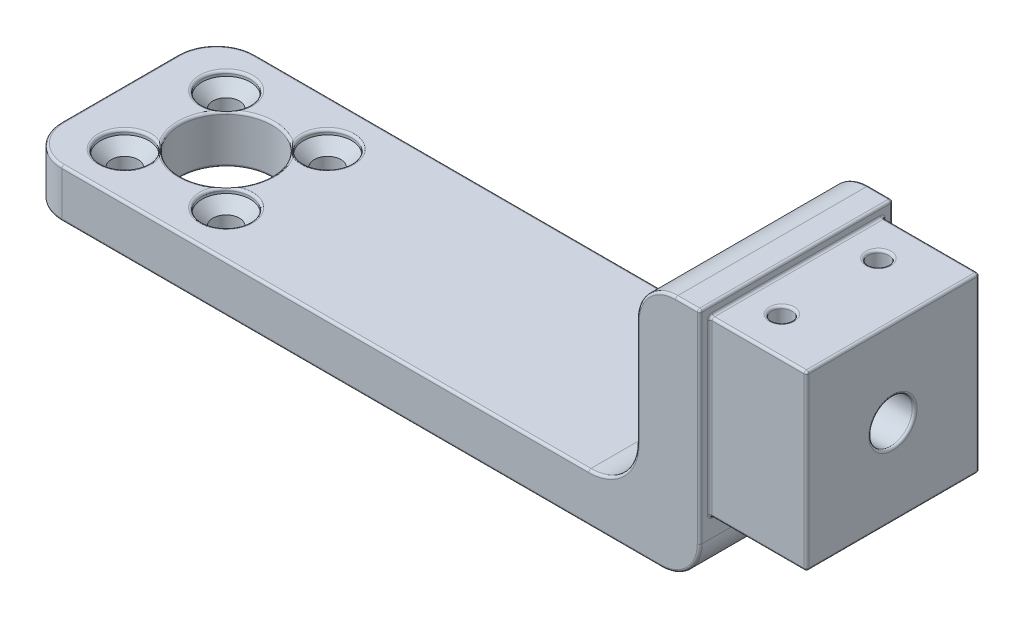
from build123d import *

# Parameters (mm, degrees)
AUFSATZ_LINEAR_AUSTRAGEN1_DEPTH              = 40
SKIZZE2_W                                    = 55.092031508714
SKIZZE2_H                                    = 41.20072241810142
SCHNITT_LINEAR_AUSTRAGEN1_DEPTH              = 20
SCHNITT_LINEAR_AUSTRAGEN2_DEPTH              = 173.33687939614086
SCHNITT_LINEAR_AUSTRAGEN2_DEPTH_BACK         = 173.33687939614086
SKIZZE4_R                                    = 9.500000000000002
FORMSENKUNG_F_R_M5_LINSENSENKSCHRAUB_2_COUNT = 2
FORMSENKUNG_F_R_M5_LINSENSENKSCHRAUB_2_PITCH = 21
FORMSENKUNG_F_R_M5_LINSENSENKSCHRAUB_3_COUNT = 2
FORMSENKUNG_F_R_M5_LINSENSENKSCHRAUB_3_PITCH = 29.698484809834994
FORMSENKUNG_F_R_M5_LINSENSENKSCHRAUB_4_COUNT = 2
FORMSENKUNG_F_R_M5_LINSENSENKSCHRAUB_4_PITCH = 20.999999999999996
VERRUNDUNG1_R                                = 8
M5_GEWINDEBOHRUNG1_D                         = 4.2
M5_GEWINDEBOHRUNG1_DEPTH                     = 15
M5_GEWINDEBOHRUNG1_TIP                       = 1.2618072999578767
M5_GEWINDEBOHRUNG2_D                         = 4.2
M5_GEWINDEBOHRUNG2_DEPTH                     = 15
M5_GEWINDEBOHRUNG2_TIP                       = 1.2618072999578767
SCHNITT_LINEAR_AUSTRAGEN3_REACH              = 174.337
SKIZZE12_R                                   = 4.500000000000003
VERRUNDUNG2_R                                = 10
VERRUNDUNG3_R                                = 0.5


with BuildPart() as part:
    # Skizze1 → Aufsatz-Linear austragen1 (new body)
    with BuildSketch(Plane.XY):
        Polygon((0, 0), (140, 0), (140, 12.09999999999999), (160, 12.099999999999984), (160, 47.900000000000006), (140, 47.9), (140, 50), (127, 50), (127, 10.000000000000005), (0, 10), align=None)
    extrude(amount=AUFSATZ_LINEAR_AUSTRAGEN1_DEPTH)

    # Skizze2 → Schnitt-Linear austragen1 (cut)
    with BuildSketch(Plane(origin=(160, 0, 0), x_dir=(0, 0, -1), z_dir=(1, 0, 0))):
        with Locations((-21.149401969108084, 29.399638790949282)):
            Rectangle(SKIZZE2_W, SKIZZE2_H)
        Polygon((-37.900000000000006, 12.09999999999999), (-2.0999999999999837, 12.099999999999996), (-2.099999999999998, 47.90000000000001), (-37.900000000000006, 47.900000000000006), align=None, mode=Mode.SUBTRACT)
    extrude(amount=-SCHNITT_LINEAR_AUSTRAGEN1_DEPTH, mode=Mode.SUBTRACT)

    # Skizze4 → Schnitt-Linear austragen2 (cut, two sides: drawn at the far end of the back side and taken through both)
    with BuildSketch(Plane.XZ.offset(-SCHNITT_LINEAR_AUSTRAGEN2_DEPTH_BACK)):
        with Locations((22, 20)):
            Circle(SKIZZE4_R)
    extrude(amount=SCHNITT_LINEAR_AUSTRAGEN2_DEPTH + SCHNITT_LINEAR_AUSTRAGEN2_DEPTH_BACK, mode=Mode.SUBTRACT)

    # Skizze6 → Formsenkung für M5 Linsensenkschraube mit Schlitz1 (revolve, cut)
    with BuildSketch(Plane(origin=(32.5, 10.000000000000002, 30.49999999999999), x_dir=(0, 0, 1), z_dir=(1, 4e-17, 0))):
        Polygon((0, 0), (-4.57e-15, 18.75236670232579), (2.749999999999996, 17.1), (2.7500000000000013, 3.249999999999996), (5, 1), (5, 0), align=None)
    formsenkung_f_r_m5_linsensenkschraube_mi = revolve(axis=Axis((32.5, 16.349999999999994, 30.49999999999999), (6e-17, -1, 0)), mode=Mode.SUBTRACT)

    # Formsenkung f_r M5 Linsensenkschraub 2: Formsenkung für M5 Linsensenkschraube mit Schlitz1 ×2
    with Locations(*[(-i * FORMSENKUNG_F_R_M5_LINSENSENKSCHRAUB_2_PITCH, 0, 0) for i in range(1, FORMSENKUNG_F_R_M5_LINSENSENKSCHRAUB_2_COUNT)]):
        add(formsenkung_f_r_m5_linsensenkschraube_mi, mode=Mode.SUBTRACT)

    # Formsenkung f_r M5 Linsensenkschraub 3: Formsenkung für M5 Linsensenkschraube mit Schlitz1 ×2
    with Locations(*[Vector(-0.7071067811865477, 0, -0.7071067811865474) * (i * FORMSENKUNG_F_R_M5_LINSENSENKSCHRAUB_3_PITCH) for i in range(1, FORMSENKUNG_F_R_M5_LINSENSENKSCHRAUB_3_COUNT)]):
        add(formsenkung_f_r_m5_linsensenkschraube_mi, mode=Mode.SUBTRACT)

    # Formsenkung f_r M5 Linsensenkschraub 4: Formsenkung für M5 Linsensenkschraube mit Schlitz1 ×2
    with Locations(*[(0, 0, -i * FORMSENKUNG_F_R_M5_LINSENSENKSCHRAUB_4_PITCH) for i in range(1, FORMSENKUNG_F_R_M5_LINSENSENKSCHRAUB_4_COUNT)]):
        add(formsenkung_f_r_m5_linsensenkschraube_mi, mode=Mode.SUBTRACT)

    # Verrundung1
    verrundung1_edges = [part.edges().sort_by_distance(p)[0] for p in [
        (0, 5, 0),
        (127, 50, 20),
        (140, 0, 20),
        (0, 5, 40),
    ]]
    fillet(verrundung1_edges, radius=VERRUNDUNG1_R)

    # M5 Gewindebohrung1
    with Locations(Plane(origin=(-1.662e-14, 47.89999999999995, 0), x_dir=(1, 3.5e-16, 0), z_dir=(-3.5e-16, 1, 0))):
        with Locations((147, -10), (147, -30)):
            Hole(M5_GEWINDEBOHRUNG1_D / 2, depth=M5_GEWINDEBOHRUNG1_DEPTH)
            with Locations((0, 0, -(M5_GEWINDEBOHRUNG1_DEPTH + M5_GEWINDEBOHRUNG1_TIP / 2))):  # 118° drill point
                Cone(0, M5_GEWINDEBOHRUNG1_D / 2, M5_GEWINDEBOHRUNG1_TIP, mode=Mode.SUBTRACT)

    # M5 Gewindebohrung2
    with Locations(Plane(origin=(4.2e-15, 12.100000000000039, 0), x_dir=(-1, 3.5e-16, 0), z_dir=(-3.5e-16, -1, 0))):
        with Locations((-147, -10), (-147, -30)):
            Hole(M5_GEWINDEBOHRUNG2_D / 2, depth=M5_GEWINDEBOHRUNG2_DEPTH)
            with Locations((0, 0, -(M5_GEWINDEBOHRUNG2_DEPTH + M5_GEWINDEBOHRUNG2_TIP / 2))):  # 118° drill point
                Cone(0, M5_GEWINDEBOHRUNG2_D / 2, M5_GEWINDEBOHRUNG2_TIP, mode=Mode.SUBTRACT)

    # Skizze12 → Schnitt-Linear austragen3 (cut, up to next)
    with BuildSketch(Plane(origin=(160, 0, 0), x_dir=(0, 0, -1), z_dir=(1, 0, 0)), mode=Mode.PRIVATE) as schnitt_linear_austragen3_sk1:
        with Locations((-20, 30.000000000000007)):
            Circle(SKIZZE12_R)
    schnitt_linear_austragen3_tool1 = extrude(schnitt_linear_austragen3_sk1.sketch, amount=-SCHNITT_LINEAR_AUSTRAGEN3_REACH, mode=Mode.PRIVATE) & part.part
    add(schnitt_linear_austragen3_tool1.solids().sort_by_distance((160, 30, 20))[0], mode=Mode.SUBTRACT)

    # Verrundung2
    verrundung2_edges = [part.edges().sort_by_distance(p)[0] for p in [
        (127, 10.000000000000005, 20),
    ]]
    fillet(verrundung2_edges, radius=VERRUNDUNG2_R)

    # Verrundung3
    # the kernel refuses this fillet: 0.5 mm, written as the material it takes off along each edge
    with BuildSketch(Plane(origin=(139.5, 49.5, 0.5), x_dir=(1, 0, 0), z_dir=(0, 0, -1))) as verrundung3_piece_1_section:
        Polygon((0, 0), (VERRUNDUNG3_R, 0), (VERRUNDUNG3_R, -VERRUNDUNG3_R), (0, -VERRUNDUNG3_R), align=None)
    verrundung3_piece_1 = extrude(amount=VERRUNDUNG3_R, mode=Mode.PRIVATE)
    verrundung3_piece_1 = verrundung3_piece_1 - Plane(origin=(139.5, 49.5, 0.5), x_dir=(-0.7071067811865475, -0.7071067811865475, 0), z_dir=(0, 0, -1)) * Sphere(VERRUNDUNG3_R, mode=Mode.PRIVATE)
    add(verrundung3_piece_1, mode=Mode.SUBTRACT)
    with BuildSketch(Plane(origin=(139.5, 49.5, 39.5), x_dir=(1, 0, 0), z_dir=(0, 1, 0))) as verrundung3_piece_2_section:
        Polygon((0, 0), (VERRUNDUNG3_R, 0), (VERRUNDUNG3_R, -VERRUNDUNG3_R), (0, -VERRUNDUNG3_R), align=None)
    verrundung3_piece_2 = extrude(amount=VERRUNDUNG3_R, mode=Mode.PRIVATE)
    verrundung3_piece_2 = verrundung3_piece_2 - Plane(origin=(139.5, 49.5, 39.5), x_dir=(-0.7071067811865475, 0, -0.7071067811865475), z_dir=(0, 1, 0)) * Sphere(VERRUNDUNG3_R, mode=Mode.PRIVATE)
    add(verrundung3_piece_2, mode=Mode.SUBTRACT)
    with BuildSketch(Plane(origin=(159.5, 47.40000000000001, 2.599999999999998), x_dir=(0, 1, 2e-16), z_dir=(0, 4e-16, -1))) as verrundung3_piece_3_section:
        Polygon((0, 0), (VERRUNDUNG3_R, 0), (VERRUNDUNG3_R, VERRUNDUNG3_R), (0, VERRUNDUNG3_R), align=None)
    verrundung3_piece_3 = extrude(amount=VERRUNDUNG3_R, mode=Mode.PRIVATE)
    verrundung3_piece_3 = verrundung3_piece_3 - Plane(origin=(159.5, 47.40000000000001, 2.599999999999998), x_dir=(-0.7071067811865475, -0.7071067811865475, 0), z_dir=(0, 4e-16, -1)) * Sphere(VERRUNDUNG3_R, mode=Mode.PRIVATE)
    add(verrundung3_piece_3, mode=Mode.SUBTRACT)
    with BuildSketch(Plane(origin=(159.5, 47.400000000000006, 37.400000000000006), x_dir=(0, 0, 1), z_dir=(0, 1, 2e-16))) as verrundung3_piece_4_section:
        Polygon((0, 0), (VERRUNDUNG3_R, 0), (VERRUNDUNG3_R, VERRUNDUNG3_R), (0, VERRUNDUNG3_R), align=None)
    verrundung3_piece_4 = extrude(amount=VERRUNDUNG3_R, mode=Mode.PRIVATE)
    verrundung3_piece_4 = verrundung3_piece_4 - Plane(origin=(159.5, 47.400000000000006, 37.400000000000006), x_dir=(-0.7071067811865475, 0, -0.7071067811865475), z_dir=(0, 1, 2e-16)) * Sphere(VERRUNDUNG3_R, mode=Mode.PRIVATE)
    add(verrundung3_piece_4, mode=Mode.SUBTRACT)
    with BuildSketch(Plane(origin=(159.5, 12.599999999999994, 37.400000000000006), x_dir=(1, 0, 0), z_dir=(0, 0, 1))) as verrundung3_piece_5_section:
        Polygon((0, 0), (VERRUNDUNG3_R, 0), (VERRUNDUNG3_R, -VERRUNDUNG3_R), (0, -VERRUNDUNG3_R), align=None)
    verrundung3_piece_5 = extrude(amount=VERRUNDUNG3_R, mode=Mode.PRIVATE)
    verrundung3_piece_5 = verrundung3_piece_5 - Plane(origin=(159.5, 12.599999999999994, 37.400000000000006), x_dir=(-0.7071067811865475, 0.7071067811865475, 0), z_dir=(0, 0, 1)) * Sphere(VERRUNDUNG3_R, mode=Mode.PRIVATE)
    add(verrundung3_piece_5, mode=Mode.SUBTRACT)
    with BuildSketch(Plane(origin=(159.5, 12.599999999999996, 2.5999999999999837), x_dir=(1, 0, 0), z_dir=(0, 4e-16, -1))) as verrundung3_piece_6_section:
        Polygon((0, 0), (VERRUNDUNG3_R, 0), (VERRUNDUNG3_R, VERRUNDUNG3_R), (0, VERRUNDUNG3_R), align=None)
    verrundung3_piece_6 = extrude(amount=VERRUNDUNG3_R, mode=Mode.PRIVATE)
    verrundung3_piece_6 = verrundung3_piece_6 - Plane(origin=(159.5, 12.599999999999996, 2.5999999999999837), x_dir=(-0.7071067811865475, 0.7071067811865475, 0), z_dir=(0, 4e-16, -1)) * Sphere(VERRUNDUNG3_R, mode=Mode.PRIVATE)
    add(verrundung3_piece_6, mode=Mode.SUBTRACT)
    with BuildSketch(Plane(origin=(32.5, 0, 30.49999999999999), x_dir=(0, 0, 1), z_dir=(-1, -6e-17, 0))) as verrundung3_piece_7:
        with BuildLine():
            CenterArc((2.7499999999999964 + VERRUNDUNG3_R, VERRUNDUNG3_R), VERRUNDUNG3_R, 180, 90)
            Line((2.7499999999999964, VERRUNDUNG3_R), (2.7499999999999964, 0))
            Line((2.7499999999999964, 0), (2.7499999999999964 + VERRUNDUNG3_R, 0))
        make_face()
    revolve(axis=Axis((32.5, 0, 30.49999999999999), (-6e-17, 1, 0)), mode=Mode.SUBTRACT)
    with BuildSketch(Plane(origin=(32.5, 10.000000000000002, 30.49999999999999), x_dir=(0, 0, 1), z_dir=(1, 6e-17, 0))) as verrundung3_piece_8:
        with BuildLine():
            CenterArc((4.9999999999999964 + VERRUNDUNG3_R, VERRUNDUNG3_R), VERRUNDUNG3_R, 180, 90)
            Line((4.9999999999999964, VERRUNDUNG3_R), (4.9999999999999964, 0))
            Line((4.9999999999999964, 0), (4.9999999999999964 + VERRUNDUNG3_R, 0))
        make_face()
    revolve(axis=Axis((32.5, 10.000000000000002, 30.49999999999999), (6e-17, -1, 0)), mode=Mode.SUBTRACT)
    with BuildSketch(Plane(origin=(140, 7.999999999999997, 0), x_dir=(-1, 0, 0), z_dir=(0, 1, 0))) as verrundung3_piece_9:
        with BuildLine():
            CenterArc((VERRUNDUNG3_R, VERRUNDUNG3_R), VERRUNDUNG3_R, 180, 90)
            Line((0, VERRUNDUNG3_R), (0, 0))
            Line((0, 0), (VERRUNDUNG3_R, 0))
        make_face()
    extrude(amount=41.5, mode=Mode.SUBTRACT)
    with BuildSketch(Plane(origin=(140, 49.5, 40), x_dir=(0, 0, -1), z_dir=(0, -1, 0))) as verrundung3_piece_10:
        with BuildLine():
            CenterArc((VERRUNDUNG3_R, -VERRUNDUNG3_R), VERRUNDUNG3_R, 90, 90)
            Line((0, -VERRUNDUNG3_R), (0, 0))
            Line((0, 0), (VERRUNDUNG3_R, 0))
        make_face()
    extrude(amount=41.5, mode=Mode.SUBTRACT)
    with BuildSketch(Plane(origin=(7.999999999999997, 0, 0), x_dir=(0, 1, 0), z_dir=(1, 0, 0))) as verrundung3_piece_11:
        with BuildLine():
            CenterArc((VERRUNDUNG3_R, VERRUNDUNG3_R), VERRUNDUNG3_R, 180, 90)
            Line((0, VERRUNDUNG3_R), (0, 0))
            Line((0, 0), (VERRUNDUNG3_R, 0))
        make_face()
    extrude(amount=124, mode=Mode.SUBTRACT)
    with BuildSketch(Plane(origin=(139.5, 50, 0), x_dir=(0, -1, 0), z_dir=(-1, 0, 0))) as verrundung3_piece_12:
        with BuildLine():
            CenterArc((VERRUNDUNG3_R, VERRUNDUNG3_R), VERRUNDUNG3_R, 180, 90)
            Line((0, VERRUNDUNG3_R), (0, 0))
            Line((0, 0), (VERRUNDUNG3_R, 0))
        make_face()
    extrude(amount=4.5, mode=Mode.SUBTRACT)
    with BuildSketch(Plane(origin=(127, 42, 0), x_dir=(1, 0, 0), z_dir=(0, -1, 0))) as verrundung3_piece_13:
        with BuildLine():
            CenterArc((VERRUNDUNG3_R, VERRUNDUNG3_R), VERRUNDUNG3_R, 180, 90)
            Line((0, VERRUNDUNG3_R), (0, 0))
            Line((0, 0), (VERRUNDUNG3_R, 0))
        make_face()
    extrude(amount=21.999999999999993, mode=Mode.SUBTRACT)
    with BuildSketch(Plane(origin=(135, 42, 0), x_dir=(0, 1, 0), z_dir=(1, 0, 0))) as verrundung3_piece_14:
        with BuildLine():
            CenterArc((8 - VERRUNDUNG3_R, VERRUNDUNG3_R), VERRUNDUNG3_R, 270, 90)
            Line((8, VERRUNDUNG3_R), (8, 0))
            Line((8, 0), (8 - VERRUNDUNG3_R, 0))
        make_face()
    revolve(axis=Axis((135, 42, 0), (0, 0, 1)), revolution_arc=90, mode=Mode.SUBTRACT)
    with BuildSketch(Plane(origin=(132, 7.999999999999998, 0), x_dir=(0, -1, 0), z_dir=(-1, 0, 0))) as verrundung3_piece_15:
        with BuildLine():
            CenterArc((8 - VERRUNDUNG3_R, VERRUNDUNG3_R), VERRUNDUNG3_R, 270, 90)
            Line((8, VERRUNDUNG3_R), (8, 0))
            Line((8, 0), (8 - VERRUNDUNG3_R, 0))
        make_face()
    revolve(axis=Axis((132, 7.999999999999998, 0), (0, 0, 1)), revolution_arc=90, mode=Mode.SUBTRACT)
    with BuildSketch(Plane(origin=(7.999999999999997, 0, 40), x_dir=(0, 0, -1), z_dir=(1, 0, 0))) as verrundung3_piece_16:
        with BuildLine():
            CenterArc((VERRUNDUNG3_R, VERRUNDUNG3_R), VERRUNDUNG3_R, 180, 90)
            Line((0, VERRUNDUNG3_R), (0, 0))
            Line((0, 0), (VERRUNDUNG3_R, 0))
        make_face()
    extrude(amount=124, mode=Mode.SUBTRACT)
    with BuildSketch(Plane(origin=(0, 0, 7.999999999999998), x_dir=(1, 0, 0), z_dir=(0, 0, 1))) as verrundung3_piece_17:
        with BuildLine():
            CenterArc((VERRUNDUNG3_R, VERRUNDUNG3_R), VERRUNDUNG3_R, 180, 90)
            Line((-6e-17, VERRUNDUNG3_R), (0, 0))
            Line((0, 0), (VERRUNDUNG3_R, 0))
        make_face()
    extrude(amount=24, mode=Mode.SUBTRACT)
    with BuildSketch(Plane(origin=(7.999999999999998, 0, 32), x_dir=(-1, 0, 0), z_dir=(0, 0, -1))) as verrundung3_piece_18:
        with BuildLine():
            CenterArc((8 - VERRUNDUNG3_R, VERRUNDUNG3_R), VERRUNDUNG3_R, 270, 90)
            Line((8, VERRUNDUNG3_R), (8, 0))
            Line((8, 0), (8 - VERRUNDUNG3_R, 0))
        make_face()
    revolve(axis=Axis((7.999999999999998, 0, 32), (0, 1, 0)), revolution_arc=90, mode=Mode.SUBTRACT)
    with BuildSketch(Plane(origin=(7.999999999999998, 0, 7.999999999999998), x_dir=(-1, 0, 2.2e-16), z_dir=(2.2e-16, 0, 1))) as verrundung3_piece_19:
        with BuildLine():
            CenterArc((8 - VERRUNDUNG3_R, -VERRUNDUNG3_R), VERRUNDUNG3_R, 0, 90)
            Line((8 - VERRUNDUNG3_R, 0), (8, 0))
            Line((8, 0), (8, -VERRUNDUNG3_R))
        make_face()
    revolve(axis=Axis((7.999999999999998, 0, 7.999999999999998), (0, -1, 0)), revolution_arc=90, mode=Mode.SUBTRACT)
    with BuildSketch(Plane(origin=(127, 42, 40), x_dir=(0, 0, -1), z_dir=(0, -1, 0))) as verrundung3_piece_20:
        with BuildLine():
            CenterArc((VERRUNDUNG3_R, VERRUNDUNG3_R), VERRUNDUNG3_R, 180, 90)
            Line((0, VERRUNDUNG3_R), (0, 0))
            Line((0, 0), (VERRUNDUNG3_R, 0))
        make_face()
    extrude(amount=21.999999999999993, mode=Mode.SUBTRACT)
    with BuildSketch(Plane(origin=(135, 42, 40), x_dir=(0, 1, 0), z_dir=(1, 0, 0))) as verrundung3_piece_21:
        with BuildLine():
            CenterArc((8 - VERRUNDUNG3_R, -VERRUNDUNG3_R), VERRUNDUNG3_R, 0, 90)
            Line((8 - VERRUNDUNG3_R, 0), (8, 0))
            Line((8, 0), (8, -VERRUNDUNG3_R))
        make_face()
    revolve(axis=Axis((135, 42, 40), (0, 0, 1)), revolution_arc=90, mode=Mode.SUBTRACT)
    with BuildSketch(Plane(origin=(132, 7.999999999999998, 40), x_dir=(0, -1, 0), z_dir=(-1, 0, 0))) as verrundung3_piece_22:
        with BuildLine():
            CenterArc((8 - VERRUNDUNG3_R, -VERRUNDUNG3_R), VERRUNDUNG3_R, 0, 90)
            Line((8 - VERRUNDUNG3_R, 0), (8, 0))
            Line((8, 0), (8, -VERRUNDUNG3_R))
        make_face()
    revolve(axis=Axis((132, 7.999999999999998, 40), (0, 0, 1)), revolution_arc=90.00000000000001, mode=Mode.SUBTRACT)
    with BuildSketch(Plane(origin=(0, 10, 7.999999999999998), x_dir=(1, 0, 0), z_dir=(0, 0, 1))) as verrundung3_piece_23:
        with BuildLine():
            CenterArc((VERRUNDUNG3_R, -VERRUNDUNG3_R), VERRUNDUNG3_R, 90, 90)
            Line((0, -VERRUNDUNG3_R), (0, 0))
            Line((0, 0), (VERRUNDUNG3_R, 0))
        make_face()
    extrude(amount=24, mode=Mode.SUBTRACT)
    with BuildSketch(Plane(origin=(7.999999999999998, 10, 32), x_dir=(-1, 0, 0), z_dir=(0, 0, -1))) as verrundung3_piece_24:
        with BuildLine():
            CenterArc((8 - VERRUNDUNG3_R, -VERRUNDUNG3_R), VERRUNDUNG3_R, 0, 90)
            Line((7.999999999999998, -VERRUNDUNG3_R), (8, 0))
            Line((8, 0), (8 - VERRUNDUNG3_R, 0))
        make_face()
    revolve(axis=Axis((7.999999999999998, 10, 32), (0, 1, 0)), revolution_arc=90, mode=Mode.SUBTRACT)
    with BuildSketch(Plane(origin=(7.999999999999998, 10, 7.999999999999998), x_dir=(-1, 0, 2.2e-16), z_dir=(2.2e-16, 0, 1))) as verrundung3_piece_25:
        with BuildLine():
            CenterArc((8 - VERRUNDUNG3_R, VERRUNDUNG3_R), VERRUNDUNG3_R, 270, 90)
            Line((7.999999999999998, VERRUNDUNG3_R), (8, 0))
            Line((8, 0), (8 - VERRUNDUNG3_R, 0))
        make_face()
    revolve(axis=Axis((7.999999999999998, 10, 7.999999999999998), (0, -1, 0)), revolution_arc=90, mode=Mode.SUBTRACT)
    with BuildSketch(Plane(origin=(146.99999999999997, 47.900000000000006, 30), x_dir=(-1, 0, 0), z_dir=(0, 0, 1))) as verrundung3_piece_26:
        with BuildLine():
            CenterArc((2.0999999999999943 + VERRUNDUNG3_R, VERRUNDUNG3_R), VERRUNDUNG3_R, 180, 90)
            Line((2.0999999999999943, VERRUNDUNG3_R), (2.0999999999999943, 0))
            Line((2.0999999999999943, 0), (2.0999999999999943 + VERRUNDUNG3_R, 0))
        make_face()
    revolve(axis=Axis((146.99999999999997, 47.900000000000006, 30), (3.5e-16, -1, 0)), mode=Mode.SUBTRACT)
    with BuildSketch(Plane(origin=(146.99999999999997, 47.90000000000001, 10), x_dir=(-1, 0, 0), z_dir=(0, 0, 1))) as verrundung3_piece_27:
        with BuildLine():
            CenterArc((2.0999999999999943 + VERRUNDUNG3_R, VERRUNDUNG3_R), VERRUNDUNG3_R, 180, 90)
            Line((2.0999999999999943, VERRUNDUNG3_R), (2.0999999999999943, 0))
            Line((2.0999999999999943, 0), (2.0999999999999943 + VERRUNDUNG3_R, 0))
        make_face()
    revolve(axis=Axis((146.99999999999997, 47.90000000000001, 10), (3.5e-16, -1, 0)), mode=Mode.SUBTRACT)
    with BuildSketch(Plane(origin=(147, 12.09999999999999, 30), x_dir=(1, 0, 0), z_dir=(0, 0, 1))) as verrundung3_piece_28:
        with BuildLine():
            CenterArc((2.0999999999999943 + VERRUNDUNG3_R, VERRUNDUNG3_R), VERRUNDUNG3_R, 180.0000000000002, 89.99999999999977)
            Line((2.0999999999999943, VERRUNDUNG3_R), (2.0999999999999943, 0))
            Line((2.0999999999999943, 0), (2.0999999999999943 + VERRUNDUNG3_R, 1.78e-15))
        make_face()
    revolve(axis=Axis((147, 12.09999999999999, 30), (3.5e-16, 1, 0)), mode=Mode.SUBTRACT)
    with BuildSketch(Plane(origin=(147, 12.099999999999994, 10), x_dir=(1, 0, 0), z_dir=(0, 0, 1))) as verrundung3_piece_29:
        with BuildLine():
            CenterArc((2.0999999999999943 + VERRUNDUNG3_R, VERRUNDUNG3_R), VERRUNDUNG3_R, 180, 90)
            Line((2.0999999999999943, VERRUNDUNG3_R), (2.0999999999999943, 0))
            Line((2.0999999999999943, 0), (2.0999999999999943 + VERRUNDUNG3_R, 0))
        make_face()
    revolve(axis=Axis((147, 12.099999999999994, 10), (3.5e-16, 1, 0)), mode=Mode.SUBTRACT)
    with BuildSketch(Plane(origin=(140, 50, 0.5), x_dir=(-1, 0, 0), z_dir=(0, 0, 1))) as verrundung3_piece_30:
        with BuildLine():
            CenterArc((VERRUNDUNG3_R, VERRUNDUNG3_R), VERRUNDUNG3_R, 180, 90)
            Line((0, VERRUNDUNG3_R), (0, 0))
            Line((0, 0), (VERRUNDUNG3_R, 0))
        make_face()
    extrude(amount=39, mode=Mode.SUBTRACT)
    with BuildSketch(Plane(origin=(160, 30.000000000000007, 20), x_dir=(0, 0, -1), z_dir=(0, -1, 0))) as verrundung3_piece_31:
        with BuildLine():
            CenterArc((4.5000000000000036 + VERRUNDUNG3_R, -VERRUNDUNG3_R), VERRUNDUNG3_R, 90, 90)
            Line((4.5000000000000036 + VERRUNDUNG3_R, 0), (4.5000000000000036, 0))
            Line((4.5000000000000036, 0), (4.5000000000000036, -VERRUNDUNG3_R))
        make_face()
    revolve(axis=Axis((160, 30.000000000000007, 20), (1, 0, 0)), mode=Mode.SUBTRACT)
    with BuildSketch(Plane(origin=(127, 30.000000000000007, 20), x_dir=(0, 0, -1), z_dir=(0, -1, 0))) as verrundung3_piece_32:
        with BuildLine():
            CenterArc((4.5000000000000036 + VERRUNDUNG3_R, VERRUNDUNG3_R), VERRUNDUNG3_R, 180, 90)
            Line((4.5000000000000036, VERRUNDUNG3_R), (4.5000000000000036, 0))
            Line((4.5000000000000036, 0), (4.5000000000000036 + VERRUNDUNG3_R, 0))
        make_face()
    revolve(axis=Axis((127, 30.000000000000007, 20), (1, 0, 0)), mode=Mode.SUBTRACT)
    with BuildSketch(Plane(origin=(117, 10.000000000000005, 0), x_dir=(4e-17, -1, 0), z_dir=(-1, -4e-17, 0))) as verrundung3_piece_33:
        with BuildLine():
            CenterArc((VERRUNDUNG3_R, VERRUNDUNG3_R), VERRUNDUNG3_R, 180, 90)
            Line((0, VERRUNDUNG3_R), (0, 0))
            Line((0, 0), (VERRUNDUNG3_R, 0))
        make_face()
    extrude(amount=109, mode=Mode.SUBTRACT)
    with BuildSketch(Plane(origin=(117, 10.000000000000005, 40), x_dir=(0, 0, -1), z_dir=(-1, -4e-17, 0))) as verrundung3_piece_34:
        with BuildLine():
            CenterArc((VERRUNDUNG3_R, VERRUNDUNG3_R), VERRUNDUNG3_R, 180, 90)
            Line((0, VERRUNDUNG3_R), (0, 0))
            Line((0, 0), (VERRUNDUNG3_R, 0))
        make_face()
    extrude(amount=109, mode=Mode.SUBTRACT)
    with BuildSketch(Plane(origin=(117, 20.000000000000007, 0), x_dir=(0, -1, 0), z_dir=(-1, 0, 0))) as verrundung3_piece_35:
        with BuildLine():
            CenterArc((10 + VERRUNDUNG3_R, VERRUNDUNG3_R), VERRUNDUNG3_R, 180, 90)
            Line((10, VERRUNDUNG3_R), (10, 0))
            Line((10, 0), (10 + VERRUNDUNG3_R, 0))
        make_face()
    revolve(axis=Axis((117, 20.000000000000007, 0), (0, 0, 1)), revolution_arc=90, mode=Mode.SUBTRACT)
    with BuildSketch(Plane(origin=(117, 20.000000000000007, 40), x_dir=(0, -1, 0), z_dir=(-1, 0, 0))) as verrundung3_piece_36:
        with BuildLine():
            CenterArc((10 + VERRUNDUNG3_R, -VERRUNDUNG3_R), VERRUNDUNG3_R, 90, 90)
            Line((10 + VERRUNDUNG3_R, 0), (10, 0))
            Line((10, 0), (10, -VERRUNDUNG3_R))
        make_face()
    revolve(axis=Axis((117, 20.000000000000007, 40), (0, 0, 1)), revolution_arc=90, mode=Mode.SUBTRACT)
    with BuildSketch(Plane(origin=(160, 47.90000000000001, 2.599999999999998), x_dir=(-1, 0, 0), z_dir=(0, -2e-16, 1))) as verrundung3_piece_37:
        with BuildLine():
            CenterArc((VERRUNDUNG3_R, VERRUNDUNG3_R), VERRUNDUNG3_R, 179.99999999999918, 90.0000000000008)
            Line((0, VERRUNDUNG3_R), (0, 0))
            Line((0, 0), (VERRUNDUNG3_R, 0))
        make_face()
    extrude(amount=34.80000000000001, mode=Mode.SUBTRACT)
    with BuildSketch(Plane(origin=(139.5, 50, 40), x_dir=(0, 0, -1), z_dir=(-1, 0, 0))) as verrundung3_piece_38:
        with BuildLine():
            CenterArc((VERRUNDUNG3_R, VERRUNDUNG3_R), VERRUNDUNG3_R, 180, 90)
            Line((0, VERRUNDUNG3_R), (0, 0))
            Line((0, 0), (VERRUNDUNG3_R, 0))
        make_face()
    extrude(amount=4.5, mode=Mode.SUBTRACT)
    with BuildSketch(Plane(origin=(160, 12.09999999999999, 37.400000000000006), x_dir=(-1, 0, 0), z_dir=(0, 1.5e-16, -1))) as verrundung3_piece_39:
        with BuildLine():
            CenterArc((VERRUNDUNG3_R, VERRUNDUNG3_R), VERRUNDUNG3_R, 180, 90)
            Line((0, VERRUNDUNG3_R), (0, 0))
            Line((0, 0), (VERRUNDUNG3_R, 0))
        make_face()
    extrude(amount=34.80000000000002, mode=Mode.SUBTRACT)
    with BuildSketch(Plane(origin=(159.5, 47.900000000000006, 37.900000000000006), x_dir=(0, 0, -1), z_dir=(-1, 0, 0))) as verrundung3_piece_40:
        with BuildLine():
            CenterArc((VERRUNDUNG3_R, VERRUNDUNG3_R), VERRUNDUNG3_R, 180, 90)
            Line((0, VERRUNDUNG3_R), (0, 0))
            Line((0, 0), (VERRUNDUNG3_R, 0))
        make_face()
    extrude(amount=19.5, mode=Mode.SUBTRACT)
    with BuildSketch(Plane(origin=(160, 47.400000000000006, 37.900000000000006), x_dir=(-1, 0, 0), z_dir=(0, -1, 0))) as verrundung3_piece_41:
        with BuildLine():
            CenterArc((VERRUNDUNG3_R, VERRUNDUNG3_R), VERRUNDUNG3_R, 180, 90)
            Line((0, VERRUNDUNG3_R), (0, 0))
            Line((0, 0), (VERRUNDUNG3_R, 0))
        make_face()
    extrude(amount=34.80000000000001, mode=Mode.SUBTRACT)
    with BuildSketch(Plane(origin=(159.5, 47.90000000000001, 2.099999999999998), x_dir=(0, -1, 0), z_dir=(-1, 0, 0))) as verrundung3_piece_42:
        with BuildLine():
            CenterArc((VERRUNDUNG3_R, VERRUNDUNG3_R), VERRUNDUNG3_R, 180, 90)
            Line((0, VERRUNDUNG3_R), (0, 0))
            Line((0, 0), (VERRUNDUNG3_R, 0))
        make_face()
    extrude(amount=19.5, mode=Mode.SUBTRACT)
    with BuildSketch(Plane(origin=(159.5, 12.099999999999996, 2.0999999999999837), x_dir=(0, 0, 1), z_dir=(-1, 0, 0))) as verrundung3_piece_43:
        with BuildLine():
            CenterArc((VERRUNDUNG3_R, VERRUNDUNG3_R), VERRUNDUNG3_R, 180, 90)
            Line((-3.55e-15, VERRUNDUNG3_R), (0, 0))
            Line((0, 0), (VERRUNDUNG3_R, 0))
        make_face()
    extrude(amount=19.5, mode=Mode.SUBTRACT)
    with BuildSketch(Plane(origin=(160, 12.599999999999996, 2.0999999999999837), x_dir=(-1, 0, 0), z_dir=(0, 1, 4e-16))) as verrundung3_piece_44:
        with BuildLine():
            CenterArc((VERRUNDUNG3_R, VERRUNDUNG3_R), VERRUNDUNG3_R, 180, 90)
            Line((0, VERRUNDUNG3_R), (0, 0))
            Line((0, 0), (VERRUNDUNG3_R, 0))
        make_face()
    extrude(amount=34.80000000000002, mode=Mode.SUBTRACT)
    with BuildSketch(Plane(origin=(159.5, 12.09999999999999, 37.900000000000006), x_dir=(0, 0, -1), z_dir=(-1, 0, 0))) as verrundung3_piece_45:
        with BuildLine():
            CenterArc((VERRUNDUNG3_R, -VERRUNDUNG3_R), VERRUNDUNG3_R, 90, 90.0000000000004)
            Line((0, -VERRUNDUNG3_R), (0, 0))
            Line((0, 0), (VERRUNDUNG3_R, 0))
        make_face()
    extrude(amount=19.5, mode=Mode.SUBTRACT)
    with BuildSketch(Plane(origin=(22, 10.000000000000002, 20), x_dir=(1, 0, 0), z_dir=(0, 0, -1))) as verrundung3_piece_46:
        with BuildLine():
            CenterArc((9.5 + VERRUNDUNG3_R, VERRUNDUNG3_R), VERRUNDUNG3_R, 180, 90)
            Line((9.5, VERRUNDUNG3_R), (9.5, 0))
            Line((9.5, 0), (9.5 + VERRUNDUNG3_R, 0))
        make_face()
    revolve(axis=Axis((22, 10.000000000000002, 20), (0, -1, 0)), mode=Mode.SUBTRACT)
    with BuildSketch(Plane(origin=(22, 0, 20), x_dir=(1, 0, 0), z_dir=(0, 0, -1))) as verrundung3_piece_47:
        with BuildLine():
            CenterArc((9.5 + VERRUNDUNG3_R, -VERRUNDUNG3_R), VERRUNDUNG3_R, 90, 90)
            Line((9.5, -VERRUNDUNG3_R), (9.5, 0))
            Line((9.5, 0), (9.5 + VERRUNDUNG3_R, 0))
        make_face()
    revolve(axis=Axis((22, 0, 20), (0, -1, 0)), mode=Mode.SUBTRACT)
    with BuildSketch(Plane(origin=(32.49999999999999, 0, 9.499999999999993), x_dir=(0, 0, 1), z_dir=(-1, -6e-17, 0))) as verrundung3_piece_48:
        with BuildLine():
            CenterArc((2.7499999999999964 + VERRUNDUNG3_R, VERRUNDUNG3_R), VERRUNDUNG3_R, 180, 90)
            Line((2.7499999999999964, VERRUNDUNG3_R), (2.7499999999999964, 0))
            Line((2.7499999999999964, 0), (2.7499999999999964 + VERRUNDUNG3_R, 0))
        make_face()
    revolve(axis=Axis((32.49999999999999, 0, 9.499999999999993), (-6e-17, 1, 0)), mode=Mode.SUBTRACT)
    with BuildSketch(Plane(origin=(32.49999999999999, 10.000000000000002, 9.499999999999993), x_dir=(0, 0, 1), z_dir=(1, 6e-17, 0))) as verrundung3_piece_49:
        with BuildLine():
            CenterArc((4.9999999999999964 + VERRUNDUNG3_R, VERRUNDUNG3_R), VERRUNDUNG3_R, 180, 90)
            Line((4.9999999999999964, VERRUNDUNG3_R), (4.9999999999999964, 0))
            Line((4.9999999999999964, 0), (4.9999999999999964 + VERRUNDUNG3_R, 0))
        make_face()
    revolve(axis=Axis((32.49999999999999, 10.000000000000002, 9.499999999999993), (6e-17, -1, 0)), mode=Mode.SUBTRACT)
    with BuildSketch(Plane(origin=(11.499999999999996, 0, 9.499999999999996), x_dir=(0, 0, 1), z_dir=(-1, -6e-17, 0))) as verrundung3_piece_50:
        with BuildLine():
            CenterArc((2.7499999999999964 + VERRUNDUNG3_R, VERRUNDUNG3_R), VERRUNDUNG3_R, 180, 90)
            Line((2.7499999999999964, VERRUNDUNG3_R), (2.7499999999999964, 0))
            Line((2.7499999999999964, 0), (2.7499999999999964 + VERRUNDUNG3_R, 0))
        make_face()
    revolve(axis=Axis((11.499999999999996, 0, 9.499999999999996), (-6e-17, 1, 0)), mode=Mode.SUBTRACT)
    with BuildSketch(Plane(origin=(11.499999999999996, 10, 9.499999999999996), x_dir=(0, 0, 1), z_dir=(1, 6e-17, 0))) as verrundung3_piece_51:
        with BuildLine():
            CenterArc((4.9999999999999964 + VERRUNDUNG3_R, VERRUNDUNG3_R), VERRUNDUNG3_R, 180, 90)
            Line((4.9999999999999964, VERRUNDUNG3_R), (4.9999999999999964, 0))
            Line((4.9999999999999964, 0), (4.9999999999999964 + VERRUNDUNG3_R, 0))
        make_face()
    revolve(axis=Axis((11.499999999999996, 10, 9.499999999999996), (6e-17, -1, 0)), mode=Mode.SUBTRACT)
    with BuildSketch(Plane(origin=(11.5, 0, 30.499999999999996), x_dir=(0, 0, 1), z_dir=(-1, -6e-17, 0))) as verrundung3_piece_52:
        with BuildLine():
            CenterArc((2.7499999999999964 + VERRUNDUNG3_R, VERRUNDUNG3_R), VERRUNDUNG3_R, 180, 90)
            Line((2.7499999999999964, VERRUNDUNG3_R), (2.7499999999999964, 0))
            Line((2.7499999999999964, 0), (2.7499999999999964 + VERRUNDUNG3_R, 0))
        make_face()
    revolve(axis=Axis((11.5, 0, 30.499999999999996), (-6e-17, 1, 0)), mode=Mode.SUBTRACT)
    with BuildSketch(Plane(origin=(11.5, 10, 30.499999999999996), x_dir=(0, 0, 1), z_dir=(1, 6e-17, 0))) as verrundung3_piece_53:
        with BuildLine():
            CenterArc((4.9999999999999964 + VERRUNDUNG3_R, VERRUNDUNG3_R), VERRUNDUNG3_R, 180, 90)
            Line((4.9999999999999964, VERRUNDUNG3_R), (4.9999999999999964, 0))
            Line((4.9999999999999964, 0), (4.9999999999999964 + VERRUNDUNG3_R, 0))
        make_face()
    revolve(axis=Axis((11.5, 10, 30.499999999999996), (6e-17, -1, 0)), mode=Mode.SUBTRACT)
    # the kernel refuses this fillet: 0.5 mm, written as the material it adds along each edge
    with BuildSketch(Plane(origin=(140, 47.90000000000001, 2.599999999999998), x_dir=(0, 1, 2e-16), z_dir=(0, -2e-16, 1)), Plane(origin=(140, 47.400000000000006, 37.900000000000006), x_dir=(0, 0, 1), z_dir=(0, -1, 0))) as verrundung3_2_piece_1:
        with BuildLine():
            CenterArc((VERRUNDUNG3_R, -VERRUNDUNG3_R), VERRUNDUNG3_R, 90, 90)
            Line((0, -VERRUNDUNG3_R), (0, 0))
            Line((0, 0), (VERRUNDUNG3_R, 0))
        make_face()
    extrude(amount=34.80000000000001)
    with BuildSketch(Plane(origin=(140, 12.09999999999999, 37.400000000000006), x_dir=(0, -1, -1.5e-16), z_dir=(0, 1.5e-16, -1))) as verrundung3_2_piece_2:
        with BuildLine():
            CenterArc((VERRUNDUNG3_R, -VERRUNDUNG3_R), VERRUNDUNG3_R, 90, 90)
            Line((0, -VERRUNDUNG3_R), (0, 0))
            Line((0, 0), (VERRUNDUNG3_R, 0))
        make_face()
    extrude(amount=34.800000000000026)
    with BuildSketch(Plane(origin=(140, 12.599999999999996, 2.0999999999999837), x_dir=(0, 4e-16, -1), z_dir=(0, 1, 4e-16))) as verrundung3_2_piece_3:
        with BuildLine():
            CenterArc((VERRUNDUNG3_R, -VERRUNDUNG3_R), VERRUNDUNG3_R, 90, 90)
            Line((0, -VERRUNDUNG3_R), (0, 0))
            Line((0, 0), (VERRUNDUNG3_R, 0))
        make_face()
    extrude(amount=34.80000000000002)
    with BuildSketch(Plane(origin=(140, 47.400000000000006, 37.400000000000006), x_dir=(0, 1, 0), z_dir=(0, 0, -1))) as verrundung3_2_piece_4:
        with BuildLine():
            CenterArc((0.5 + VERRUNDUNG3_R, VERRUNDUNG3_R), VERRUNDUNG3_R, 180, 90)
            Line((0.5, VERRUNDUNG3_R), (0.5, 0))
            Line((0.5, 0), (0.5 + VERRUNDUNG3_R, 0))
        make_face()
    revolve(axis=Axis((140, 47.400000000000006, 37.400000000000006), (1, 0, 0)), revolution_arc=90)
    with BuildSketch(Plane(origin=(140, 12.59999999999999, 37.400000000000006), x_dir=(0, -1, 0), z_dir=(0, 0, -1))) as verrundung3_2_piece_5:
        with BuildLine():
            CenterArc((0.5 + VERRUNDUNG3_R, -VERRUNDUNG3_R), VERRUNDUNG3_R, 90, 90)
            Line((0.5, -VERRUNDUNG3_R), (0.5, 0))
            Line((0.5, 0), (0.5 + VERRUNDUNG3_R, 0))
        make_face()
    revolve(axis=Axis((140, 12.59999999999999, 37.400000000000006), (-1, 0, 0)), revolution_arc=90.00000000000041)
    with BuildSketch(Plane(origin=(140, 12.599999999999996, 2.59999999999998), x_dir=(0, -1, 0), z_dir=(0, 0, 1))) as verrundung3_2_piece_6:
        with BuildLine():
            CenterArc((0.5 + VERRUNDUNG3_R, VERRUNDUNG3_R), VERRUNDUNG3_R, 180, 90)
            Line((0.5, VERRUNDUNG3_R), (0.5, 0))
            Line((0.5, 0), (0.5 + VERRUNDUNG3_R, 0))
        make_face()
    revolve(axis=Axis((140, 12.599999999999996, 2.59999999999998), (1, 0, 0)), revolution_arc=90)
    with BuildSketch(Plane(origin=(140, 47.40000000000001, 2.599999999999998), x_dir=(0, 0, -1), z_dir=(0, -1, 0))) as verrundung3_2_piece_7:
        with BuildLine():
            CenterArc((0.5 + VERRUNDUNG3_R, VERRUNDUNG3_R), VERRUNDUNG3_R, 180, 90)
            Line((0.5, VERRUNDUNG3_R), (0.5, 0))
            Line((0.5, 0), (0.5 + VERRUNDUNG3_R, 0))
        make_face()
    revolve(axis=Axis((140, 47.40000000000001, 2.599999999999998), (1, 0, 0)), revolution_arc=90)


solid = part.part
